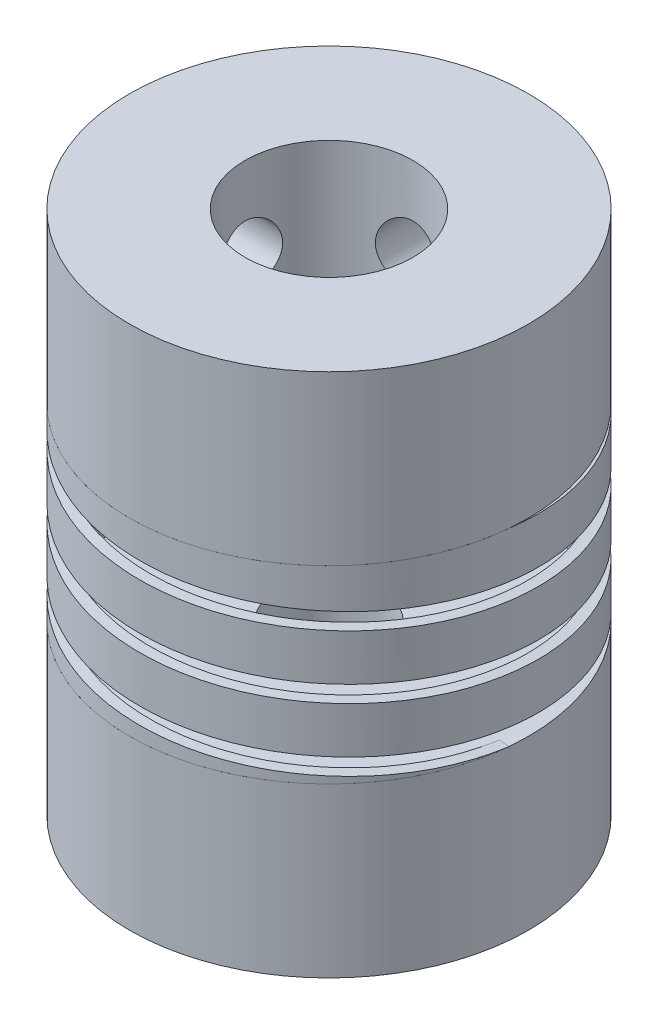
from build123d import *

# Parameters (mm, degrees)
SKETCH_3_R               = 9.5
EXTRUDE_8_DEPTH          = 8
SKETCH_6_R               = 2.5
CUT_EXTRUDE_1_DEPTH      = 8
SKETCH_7_R               = 1.5
CUT_EXTRUDE_2_DEPTH      = 10
PATTERN_CIRCULAR_2_COUNT = 2
PATTERN_CIRCULAR_2_ANGLE = 90
SKETCH_8_R               = 9.5
EXTRUDE_9_DEPTH          = 9
SKETCH_9_R               = 9.5
EXTRUDE_10_DEPTH         = 8
SKETCH_10_R              = 4
CUT_EXTRUDE_3_DEPTH      = 8
SKETCH_11_R              = 1.5
CUT_EXTRUDE_4_DEPTH      = 10
PATTERN_CIRCULAR_3_COUNT = 2
PATTERN_CIRCULAR_3_ANGLE = 90
SWEEP_1_PITCH            = 3
SWEEP_1_FROM             = 0
SWEEP_1_TO               = 9
SKETCH_15_R              = 8.99500782
CUT_EXTRUDE_5_DEPTH      = 10


with BuildPart() as part:
    # 草图3 → 凸台-拉伸8 (new body)
    with BuildSketch(Plane(origin=(0, 0, 0), x_dir=(1, 0, 0), z_dir=(0, 1, 0))):
        with Locations(Location((0, 0, 0), (0, 0, 270))):
            Circle(SKETCH_3_R)
    extrude(amount=EXTRUDE_8_DEPTH)

    # 草图6 → 切除-拉伸1 (cut)
    with BuildSketch(Plane.XZ):
        with Locations(Location((0, 0, 0), (0, 0, 270))):
            Circle(SKETCH_6_R)
    extrude(amount=-CUT_EXTRUDE_1_DEPTH, mode=Mode.SUBTRACT)

    # 草图7 → 切除-拉伸2 (cut)
    with BuildSketch(Plane(origin=(0, 0, 0), x_dir=(0, 0, -1), z_dir=(1, 0, 0))):
        with Locations((0, 4)):
            Circle(SKETCH_7_R)
    cut_extrude_2 = extrude(amount=-CUT_EXTRUDE_2_DEPTH, mode=Mode.SUBTRACT)

    # 阵列(圆周)2: 切除-拉伸2 ×2 about axis
    pattern_circular_2_axis = Axis((0, 8, 0), (0, -1, 0))
    for i in range(1, PATTERN_CIRCULAR_2_COUNT):
        add(cut_extrude_2.rotate(pattern_circular_2_axis, i * PATTERN_CIRCULAR_2_ANGLE / (PATTERN_CIRCULAR_2_COUNT - 1)), mode=Mode.SUBTRACT)


with BuildPart() as body_2:
    # 草图8 → 凸台-拉伸9 (new body)
    with BuildSketch(Plane(origin=(0, 8, 0), x_dir=(1, 0, 0), z_dir=(0, 1, 0))):
        with Locations(Location((0, 0, 0), (0, 0, 270))):
            Circle(SKETCH_8_R)
    extrude(amount=EXTRUDE_9_DEPTH)

    # 切除-扫描1: arcs per turn and ends read off the stored shape
    # 切除-扫描1: the profile of 草图14 profile screwed along a left-hand helix through 4.6 turns, 10 arcs to a turn; built about Z, then put on its axis
    sweep_1_z = Axis((0, 0, 0), (0, 0, 1))
    sweep_1_corners = [(9.5003, 0, -3), (8.99500782, 0, -3), (8.99500782, 0, -2.204791488), (9.5003, 0, -2.204791488)]
    with BuildLine(mode=Mode.PRIVATE) as sweep_1_profile:
        Line(sweep_1_corners[0], sweep_1_corners[1])
        Line(sweep_1_corners[1], sweep_1_corners[2])
        Line(sweep_1_corners[2], sweep_1_corners[3])
        Line(sweep_1_corners[3], sweep_1_corners[0])
    sweep_1_cap = Face(sweep_1_profile.wire())
    sweep_1_turn_angles = [0, -18, -36, -54, -72, -90, -108, -126, -144, -162, -180, -198, -216, -234, -252, -270, -288, -306, -324, -342, -360]
    sweep_1_turn_weights = [1, 0.9510565162951535, 1, 0.9510565162951535, 1, 0.9510565162951535, 1, 0.9510565162951535, 1, 0.9510565162951535, 1, 0.9510565162951535, 1, 0.9510565162951535, 1, 0.9510565162951535, 1, 0.9510565162951535, 1, 0.9510565162951535, 1]
    sweep_1_turn_rails = [Edge.make_bspline([Vector(p[0], p[1], 0).rotate(sweep_1_z, sweep_1_turn_angles[k]) / sweep_1_turn_weights[k] + Vector(0, 0, p[2] + -SWEEP_1_PITCH * sweep_1_turn_angles[k] / 360) for k in range(21)], [0, 0, 0, 1, 1, 2, 2, 3, 3, 4, 4, 5, 5, 6, 6, 7, 7, 8, 8, 9, 9, 10, 10, 10], 2, sweep_1_turn_weights) for p in sweep_1_corners]
    sweep_1_turn_sides = [Face.make_surface_from_curves(sweep_1_turn_rails[p[0]], sweep_1_turn_rails[p[1]]) for p in [(0, 1), (1, 2), (2, 3), (3, 0)]]
    sweep_1_last_angles = [-1440, -1458, -1476, -1494, -1512, -1530, -1548, -1566, -1584, -1602, -1620, -1638, -1656]
    sweep_1_last_weights = [1, 0.9510565162951535, 1, 0.9510565162951535, 1, 0.9510565162951535, 1, 0.9510565162951535, 1, 0.9510565162951535, 1, 0.9510565162951535, 1]
    sweep_1_last_rails = [Edge.make_bspline([Vector(p[0], p[1], 0).rotate(sweep_1_z, sweep_1_last_angles[k]) / sweep_1_last_weights[k] + Vector(0, 0, p[2] + -SWEEP_1_PITCH * sweep_1_last_angles[k] / 360) for k in range(13)], [0, 0, 0, 1, 1, 2, 2, 3, 3, 4, 4, 5, 5, 6, 6, 6], 2, sweep_1_last_weights) for p in sweep_1_corners]
    sweep_1_last_sides = [Face.make_surface_from_curves(sweep_1_last_rails[p[0]], sweep_1_last_rails[p[1]]) for p in [(0, 1), (1, 2), (2, 3), (3, 0)]]
    sweep_1 = Plane(origin=(0, 17, 0), x_dir=(0, 0, -1), z_dir=(0, -1, 0)) * split(split(Solid(Shell([*[p.moved(Location((0, 0, SWEEP_1_PITCH * i))) for i in range(4) for p in sweep_1_turn_sides], *sweep_1_last_sides, sweep_1_cap, sweep_1_cap.rotate(sweep_1_z, -1656).moved(Location((0, 0, -SWEEP_1_PITCH * -1656 / 360)))])), bisect_by=Plane.XY.offset(SWEEP_1_FROM), keep=Keep.TOP, mode=Mode.PRIVATE), bisect_by=Plane.XY.offset(SWEEP_1_TO), keep=Keep.BOTTOM, mode=Mode.PRIVATE)
    add(sweep_1, mode=Mode.SUBTRACT)

    # 草图15 → 切除-拉伸5 (cut)
    with BuildSketch(Plane(origin=(0, 17, 0), x_dir=(1, 0, 0), z_dir=(0, 1, 0))):
        Circle(SKETCH_15_R)
    extrude(amount=-CUT_EXTRUDE_5_DEPTH, mode=Mode.SUBTRACT)


with BuildPart() as body_3:
    # 草图9 → 凸台-拉伸10 (new body)
    with BuildSketch(Plane(origin=(0, 17, 0), x_dir=(1, 0, 0), z_dir=(0, 1, 0))):
        with Locations(Location((0, 0, 0), (0, 0, 270))):
            Circle(SKETCH_9_R)
    extrude(amount=EXTRUDE_10_DEPTH)

    # 草图10 → 切除-拉伸3 (cut)
    with BuildSketch(Plane(origin=(0, 25, 0), x_dir=(1, 0, 0), z_dir=(0, 1, 0))):
        with Locations(Location((0, 0, 0), (0, 0, 270))):
            Circle(SKETCH_10_R)
    extrude(amount=-CUT_EXTRUDE_3_DEPTH, mode=Mode.SUBTRACT)

    # 草图11 → 切除-拉伸4 (cut)
    with BuildSketch(Plane(origin=(0, 0, 0), x_dir=(0, 0, -1), z_dir=(1, 0, 0))):
        with Locations((0, 21)):
            Circle(SKETCH_11_R)
    cut_extrude_4 = extrude(amount=-CUT_EXTRUDE_4_DEPTH, mode=Mode.SUBTRACT)

    # 阵列(圆周)3: 切除-拉伸4 ×2 about axis
    pattern_circular_3_axis = Axis((0, 25, 0), (0, -1, 0))
    for i in range(1, PATTERN_CIRCULAR_3_COUNT):
        add(cut_extrude_4.rotate(pattern_circular_3_axis, i * PATTERN_CIRCULAR_3_ANGLE / (PATTERN_CIRCULAR_3_COUNT - 1)), mode=Mode.SUBTRACT)


solid = Compound([part.part, body_2.part, body_3.part])
